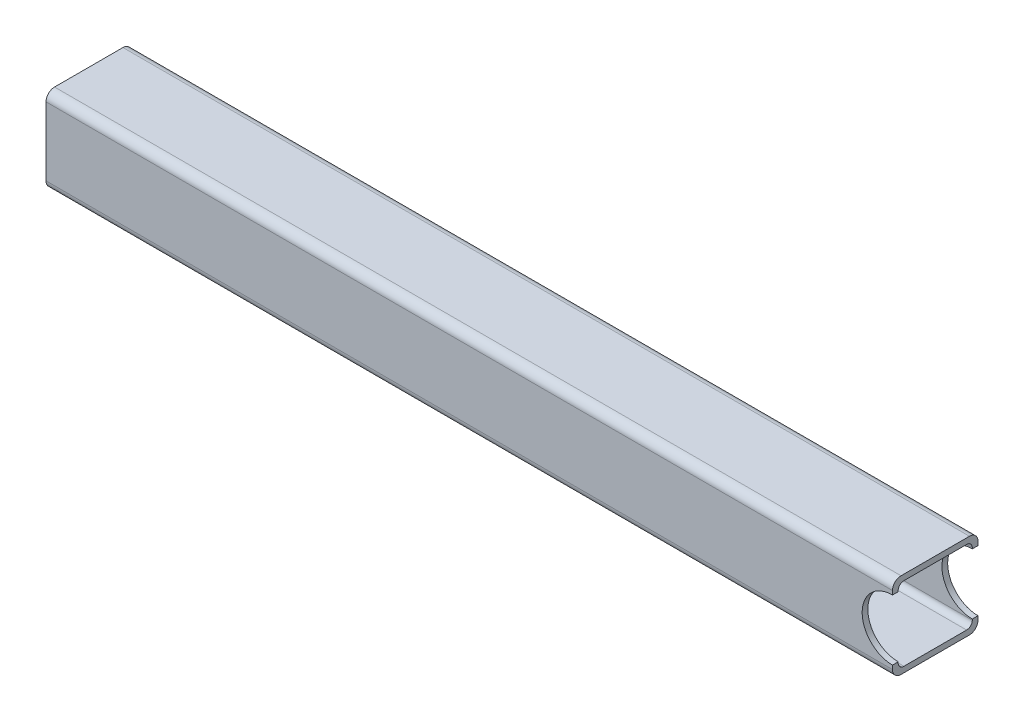
from build123d import *

# Parameters (mm, degrees)
EXTRUDE_1_DEPTH = 297.016771071
OTHER_START     = -15
OTHER_1_DEPTH   = 30


# Read off the part's stored shape, not the designer's step: Полость1
with BuildPart() as part:
    # Эскиз1 → Бобышка-Вытянуть1 (new body)
    with BuildSketch(Plane(origin=(0, 0, 0), x_dir=(0, 0, -1), z_dir=(1, 0, 0))):
        with BuildLine():
            Line((-12, 15), (12, 15))
            ThreePointArc((12, 15), (14.121320344, 14.121320344), (15, 12))
            Line((15, 12), (15, -12))
            ThreePointArc((15, -12), (14.121320344, -14.121320344), (12, -15))
            Line((12, -15), (-12, -15))
            ThreePointArc((-12, -15), (-14.121320344, -14.121320344), (-15, -12))
            Line((-15, -12), (-15, 12))
            ThreePointArc((-15, 12), (-14.121320344, 14.121320344), (-12, 15))
        make_face()
        with BuildLine():
            Line((-11, 13), (11, 13))
            ThreePointArc((11, 13), (12.414213562, 12.414213562), (13, 11))
            Line((13, 11), (13, -11))
            ThreePointArc((13, -11), (12.414213562, -12.414213562), (11, -13))
            Line((11, -13), (-11, -13))
            ThreePointArc((-11, -13), (-12.414213562, -12.414213562), (-13, -11))
            Line((-13, -11), (-13, 11))
            ThreePointArc((-13, 11), (-12.414213562, 12.414213562), (-11, 13))
        make_face(mode=Mode.SUBTRACT)
    extrude(amount=-EXTRUDE_1_DEPTH)

    # Полость1 outline → Полость1 (cut)
    with BuildSketch(Plane.XY.offset(OTHER_START)):
        with BuildLine():
            Line((0, -10.65), (0, 10.65))
            ThreePointArc((0, 10.65), (-10.65, 0), (0, -10.65))
        make_face()
    extrude(amount=OTHER_1_DEPTH, mode=Mode.SUBTRACT)


solid = part.part
